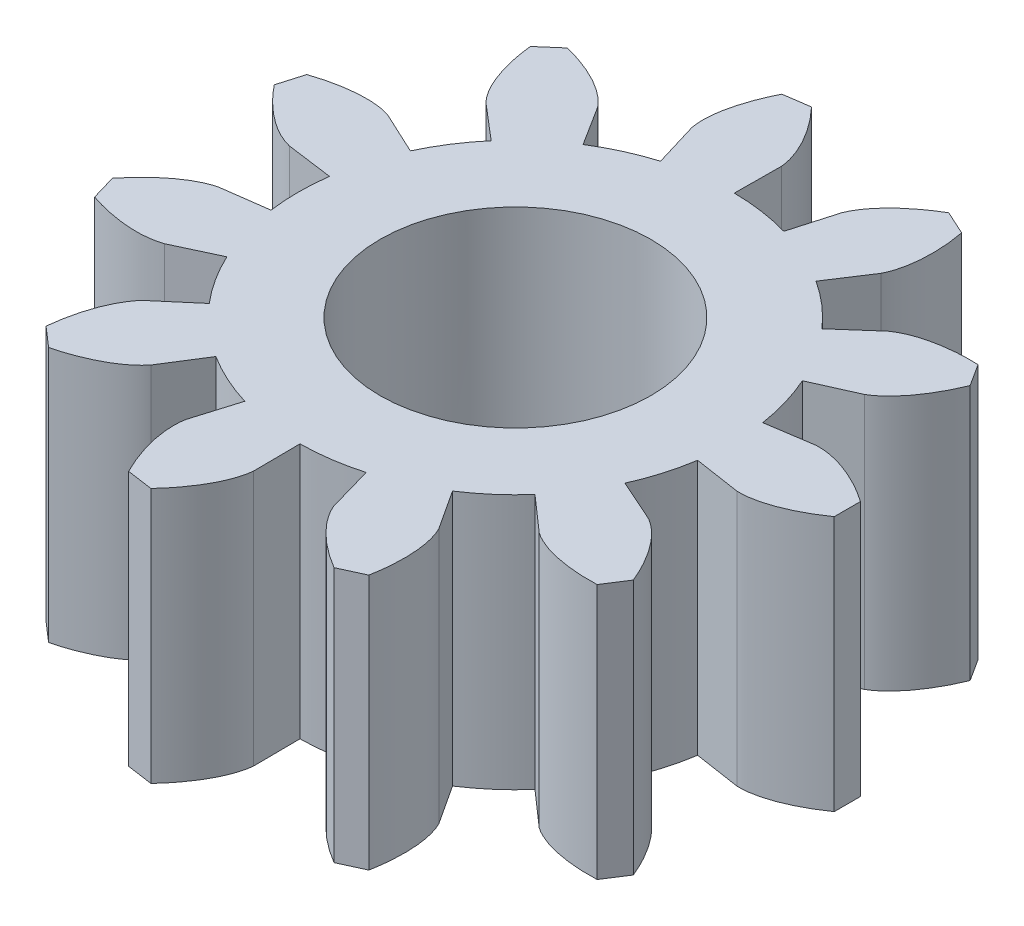
from build123d import *

# Parameters (mm, degrees)
BOSS_EXTRUDE1_DEPTH     = 5
CUT_EXTRUDE1_DEPTH      = 11.43956726
CUT_EXTRUDE1_DEPTH_BACK = 11.43956726
SKETCH2_R               = 2.65


with BuildPart() as part:
    # Sketch1 → Boss-Extrude1 (new body)
    with BuildSketch(Plane.XZ.offset(5)):
        with BuildLine():
            Line((3.190229537, -2.808012732), (3.879551376, -3.414747915))
            add(Edge.make_bspline(
                [(3.879551376, -3.414747915), (4.371081204, -3.768547035), (5.325327031, -3.7270487)],
                knots=[3.664389894, 3.664389894, 3.664389894, 4.719659584, 4.719659584, 4.719659584], degree=2, weights=[1, 0.864000321, 1]))
            Line((5.325327031, -3.7270487), (5.602463544, -3.295815869))
            add(Edge.make_bspline(
                [(5.602463544, -3.295815869), (5.243842932, -2.409552511), (4.717787845, -2.11042651)],
                knots=[1.542822379, 1.542822379, 1.542822379, 2.616695251, 2.616695251, 2.616695251], degree=2, weights=[1, 0.859279742, 1]))
            Line((4.717787845, -2.11042651), (3.879527469, -1.735444214))
            ThreePointArc((3.879527469, -1.735444214), (4.077845138, -1.197363367), (4.201918167, -0.637482326))
            Line((4.201918167, -0.637482326), (5.109838405, -0.775224919))
            add(Edge.make_bspline(
                [(5.109838405, -0.775224919), (5.714617855, -0.807118591), (6.494944834, -0.256303727)],
                knots=[3.664389894, 3.664389894, 3.664389894, 4.719659584, 4.719659584, 4.719659584], degree=2, weights=[1, 0.864000321, 1]))
            Line((6.494944834, -0.256303727), (6.494944834, 0.256303727))
            add(Edge.make_bspline(
                [(6.494944834, 0.256303727), (5.714103832, 0.807990967), (5.109838405, 0.775224919)],
                knots=[1.542822379, 1.542822379, 1.542822379, 2.616695251, 2.616695251, 2.616695251], degree=2, weights=[1, 0.859279742, 1]))
            Line((5.109838405, 0.775224919), (4.201918167, 0.637482326))
            ThreePointArc((4.201918167, 0.637482326), (4.077845138, 1.197363367), (3.879527469, 1.735444214))
            Line((3.879527469, 1.735444214), (4.717787845, 2.11042651))
            add(Edge.make_bspline(
                [(4.717787845, 2.11042651), (5.243803714, 2.410564302), (5.602463544, 3.295815869)],
                knots=[0.52279724, 0.52279724, 0.52279724, 1.57806693, 1.57806693, 1.57806693], degree=2, weights=[1, 0.864000321, 1]))
            Line((5.602463544, 3.295815869), (5.325327031, 3.7270487))
            add(Edge.make_bspline(
                [(5.325327031, 3.7270487), (4.370177139, 3.769003022), (3.879551376, 3.414747915)],
                knots=[1.542822379, 1.542822379, 1.542822379, 2.616695251, 2.616695251, 2.616695251], degree=2, weights=[1, 0.859279742, 1]))
            Line((3.879551376, 3.414747915), (3.190229537, 2.808012732))
            ThreePointArc((3.190229537, 2.808012732), (2.783158119, 3.211935691), (2.32541421, 3.557379478))
            Line((2.32541421, 3.557379478), (2.827872978, 4.326032434))
            add(Edge.make_bspline(
                [(2.827872978, 4.326032434), (3.108118945, 4.862910062), (2.931239663, 5.801537213)],
                knots=[0.52279724, 0.52279724, 0.52279724, 1.57806693, 1.57806693, 1.57806693], degree=2, weights=[1, 0.864000321, 1]))
            Line((2.931239663, 5.801537213), (2.464955522, 6.014482045))
            add(Edge.make_bspline(
                [(2.464955522, 6.014482045), (1.638750082, 5.533383248), (1.417534197, 4.970112574)],
                knots=[1.542822379, 1.542822379, 1.542822379, 2.616695251, 2.616695251, 2.616695251], degree=2, weights=[1, 0.859279742, 1]))
            Line((1.417534197, 4.970112574), (1.16566557, 4.087018936))
            ThreePointArc((1.16566557, 4.087018936), (0.604838063, 4.206741128), (0.032998371, 4.249871893))
            Line((0.032998371, 4.249871893), (0.040128421, 5.168153627))
            add(Edge.make_bspline(
                [(0.040128421, 5.168153627), (-0.014371628, 5.771316237), (-0.670632099, 6.465311484)],
                knots=[0.52279724, 0.52279724, 0.52279724, 1.57806693, 1.57806693, 1.57806693], degree=2, weights=[1, 0.864000321, 1]))
            Line((-0.670632099, 6.465311484), (-1.178021948, 6.392359837))
            add(Edge.make_bspline(
                [(-1.178021948, 6.392359837), (-1.612968547, 5.54095339), (-1.494540074, 4.947501609)],
                knots=[4.684415032, 4.684415032, 4.684415032, 5.758287905, 5.758287905, 5.758287905], degree=2, weights=[1, 0.859279742, 1]))
            Line((-1.494540074, 4.947501609), (-1.22898898, 4.068425505))
            ThreePointArc((-1.22898898, 4.068425505), (-1.765513805, 3.86593598), (-2.269894218, 3.59306001))
            Line((-2.269894218, 3.59306001), (-2.760356625, 4.369422559))
            add(Edge.make_bspline(
                [(-2.760356625, 4.369422559), (-3.132299311, 4.847370285), (-4.059582909, 5.076395041)],
                knots=[0.52279724, 0.52279724, 0.52279724, 1.57806693, 1.57806693, 1.57806693], degree=2, weights=[1, 0.864000321, 1]))
            Line((-4.059582909, 5.076395041), (-4.446985774, 4.740708547))
            add(Edge.make_bspline(
                [(-4.446985774, 4.740708547), (-4.352581058, 3.789309981), (-3.932108431, 3.35409384)],
                knots=[4.684415032, 4.684415032, 4.684415032, 5.758287905, 5.758287905, 5.758287905], degree=2, weights=[1, 0.859279742, 1]))
            Line((-3.932108431, 3.35409384), (-3.233448212, 2.758135722))
            ThreePointArc((-3.233448212, 2.758135722), (-3.575327515, 2.297723474), (-3.852111431, 1.795476962))
            Line((-3.852111431, 1.795476962), (-4.684447947, 2.183430702))
            add(Edge.make_bspline(
                [(-4.684447947, 2.183430702), (-5.255744094, 2.384418517), (-6.159644828, 2.07575904)],
                knots=[0.52279724, 0.52279724, 0.52279724, 1.57806693, 1.57806693, 1.57806693], degree=2, weights=[1, 0.864000321, 1]))
            Line((-6.159644828, 2.07575904), (-6.304063037, 1.58391579))
            add(Edge.make_bspline(
                [(-6.304063037, 1.58391579), (-5.710279838, 0.834587427), (-5.121260145, 0.695784976)],
                knots=[4.684415032, 4.684415032, 4.684415032, 5.758287905, 5.758287905, 5.758287905], degree=2, weights=[1, 0.859279742, 1]))
            Line((-5.121260145, 0.695784976), (-4.211310483, 0.572157336))
            ThreePointArc((-4.211310483, 0.572157336), (-4.25, 0), (-4.211310483, -0.572157336))
            Line((-4.211310483, -0.572157336), (-5.121260145, -0.695784976))
            add(Edge.make_bspline(
                [(-5.121260145, -0.695784976), (-5.710527263, -0.835569283), (-6.304063037, -1.58391579)],
                knots=[3.664389894, 3.664389894, 3.664389894, 4.719659584, 4.719659584, 4.719659584], degree=2, weights=[1, 0.864000321, 1]))
            Line((-6.304063037, -1.58391579), (-6.159644828, -2.07575904))
            add(Edge.make_bspline(
                [(-6.159644828, -2.07575904), (-5.255005116, -2.385110738), (-4.684447947, -2.183430702)],
                knots=[4.684415032, 4.684415032, 4.684415032, 5.758287905, 5.758287905, 5.758287905], degree=2, weights=[1, 0.859279742, 1]))
            Line((-4.684447947, -2.183430702), (-3.852111431, -1.795476962))
            ThreePointArc((-3.852111431, -1.795476962), (-3.575327515, -2.297723474), (-3.233448212, -2.758135722))
            Line((-3.233448212, -2.758135722), (-3.932108431, -3.35409384))
            add(Edge.make_bspline(
                [(-3.932108431, -3.35409384), (-4.352258375, -3.790269739), (-4.446985774, -4.740708547)],
                knots=[3.664389894, 3.664389894, 3.664389894, 4.719659584, 4.719659584, 4.719659584], degree=2, weights=[1, 0.864000321, 1]))
            Line((-4.446985774, -4.740708547), (-4.059582909, -5.076395041))
            add(Edge.make_bspline(
                [(-4.059582909, -5.076395041), (-3.1313034, -4.847553096), (-2.760356625, -4.369422559)],
                knots=[4.684415032, 4.684415032, 4.684415032, 5.758287905, 5.758287905, 5.758287905], degree=2, weights=[1, 0.859279742, 1]))
            Line((-2.760356625, -4.369422559), (-2.269894218, -3.59306001))
            ThreePointArc((-2.269894218, -3.59306001), (-1.765513805, -3.86593598), (-1.22898898, -4.068425505))
            Line((-1.22898898, -4.068425505), (-1.494540074, -4.947501609))
            add(Edge.make_bspline(
                [(-1.494540074, -4.947501609), (-1.612178204, -5.541586333), (-1.178021948, -6.392359837)],
                knots=[3.664389894, 3.664389894, 3.664389894, 4.719659584, 4.719659584, 4.719659584], degree=2, weights=[1, 0.864000321, 1]))
            Line((-1.178021948, -6.392359837), (-0.670632099, -6.465311484))
            add(Edge.make_bspline(
                [(-0.670632099, -6.465311484), (-0.013434979, -5.770931598), (0.040128421, -5.168153627)],
                knots=[1.542822379, 1.542822379, 1.542822379, 2.616695251, 2.616695251, 2.616695251], degree=2, weights=[1, 0.859279742, 1]))
            Line((0.040128421, -5.168153627), (0.032998371, -4.249871893))
            ThreePointArc((0.032998371, -4.249871893), (0.604838063, -4.206741128), (1.16566557, -4.087018936))
            Line((1.16566557, -4.087018936), (1.417534197, -4.970112574))
            add(Edge.make_bspline(
                [(1.417534197, -4.970112574), (1.639757156, -5.533488422), (2.464955522, -6.014482045)],
                knots=[3.664389894, 3.664389894, 3.664389894, 4.719659584, 4.719659584, 4.719659584], degree=2, weights=[1, 0.864000321, 1]))
            Line((2.464955522, -6.014482045), (2.931239663, -5.801537213))
            add(Edge.make_bspline(
                [(2.931239663, -5.801537213), (3.108698953, -4.862080092), (2.827872978, -4.326032434)],
                knots=[1.542822379, 1.542822379, 1.542822379, 2.616695251, 2.616695251, 2.616695251], degree=2, weights=[1, 0.859279742, 1]))
            Line((2.827872978, -4.326032434), (2.32541421, -3.557379478))
            ThreePointArc((2.32541421, -3.557379478), (2.783158119, -3.211935691), (3.190229537, -2.808012732))
        make_face()
    extrude(amount=-BOSS_EXTRUDE1_DEPTH)

    # Sketch2 → Cut-Extrude1 (cut, two sides: drawn at the far end of the back side and taken through both)
    with BuildSketch(Plane(origin=(0, 0, 0), x_dir=(1, 0, 0), z_dir=(0, 1, 0)).offset(-CUT_EXTRUDE1_DEPTH_BACK)):
        Circle(SKETCH2_R)
    extrude(amount=CUT_EXTRUDE1_DEPTH + CUT_EXTRUDE1_DEPTH_BACK, mode=Mode.SUBTRACT)


solid = part.part
